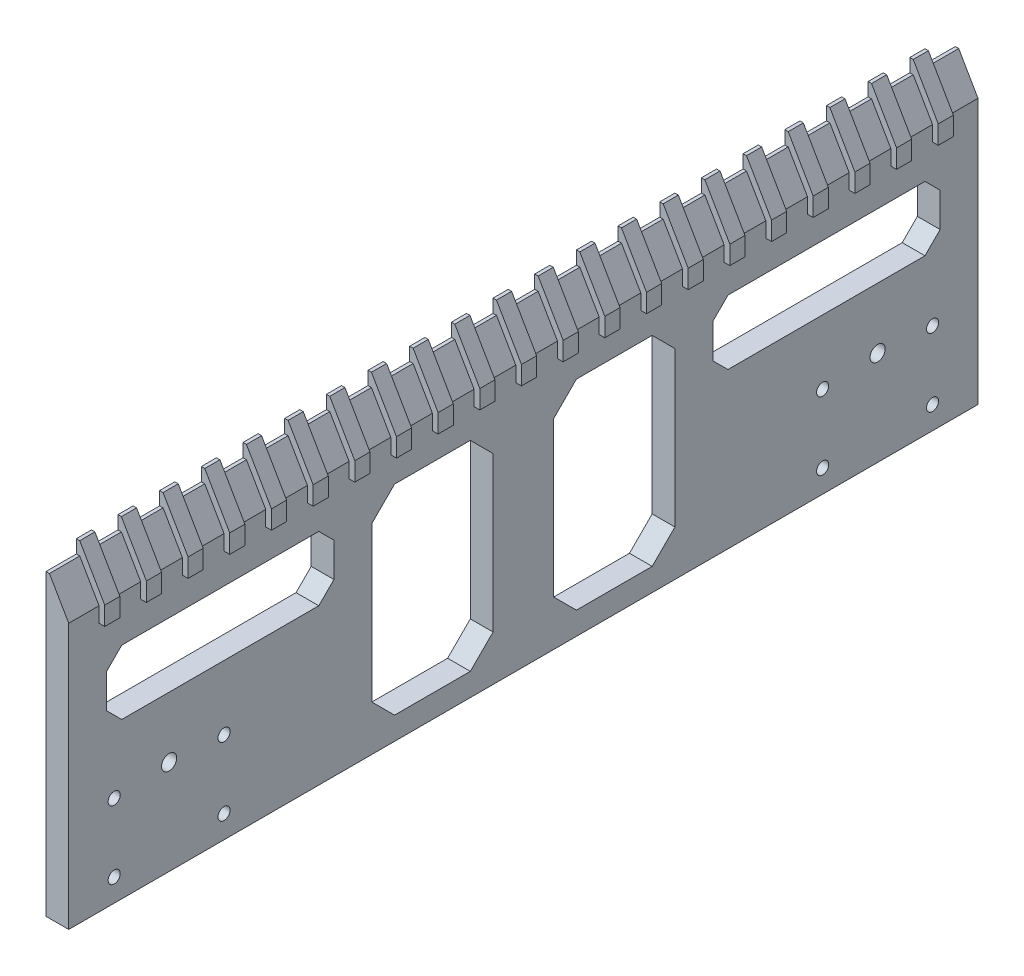
from build123d import *

# Parameters (mm, degrees)
SKETCH_1_W                  = 240
SKETCH_1_H                  = 70
EXTRUDE_1_DEPTH             = 6
CUT_EXTRUDE_2_DEPTH         = 251.071989635
EXTRUDE_2_DEPTH             = 240
EXTRUDE_3_DEPTH             = 2
PATTERN_LINEAR_1_COUNT      = 11
PATTERN_LINEAR_1_PITCH      = 11
PATTERN_LINEAR_1_COUNT_DIR2 = 11
PATTERN_LINEAR_1_PITCH_DIR2 = 11
HOLE_WIZARD_1_D             = 3.2
HOLE_WIZARD_1_CBORE_D       = 6
HOLE_WIZARD_1_CBORE_DEPTH   = 3.4
SKETCH_16_R                 = 2
CUT_EXTRUDE_3_DEPTH         = 10


with BuildPart() as part:
    # 草图1 → 凸台-拉伸1 (new body)
    with BuildSketch(Plane(origin=(0, 0, 0), x_dir=(0, 0, -1), z_dir=(1, 0, 0))):
        with Locations((120, -35)):
            Rectangle(SKETCH_1_W, SKETCH_1_H)
    extrude(amount=EXTRUDE_1_DEPTH)

    # 草图3 → 切除-拉伸2 (cut, through all)
    with BuildSketch(Plane(origin=(6, 0, 0), x_dir=(0, 0, -1), z_dir=(1, 0, 0))):
        Polygon((14, -12), (66, -12), (70, -16), (70, -25), (66, -29), (14, -29), (10, -25), (10, -16), align=None)
        Polygon((80, -17.2), (86, -11.2), (106, -11.2), (112, -17.2), (112, -58), (106, -64), (86, -64), (80, -58), align=None)
    cut_extrude_2 = extrude(amount=-CUT_EXTRUDE_2_DEPTH, mode=Mode.SUBTRACT)

    # 草图6 → 凸台-拉伸2 (add)
    with BuildSketch(Plane.XY):
        Polygon((6, 0), (0, 0), (0, 8.833459119), (0.9, 8.833459119), align=None)
    extrude(amount=-EXTRUDE_2_DEPTH)

    # 草图8 → 凸台-拉伸3 (add, symmetric)
    with BuildSketch(Plane.XY.offset(-120)):
        Polygon((0, 10.392304845), (0, 12.333459119), (0.9, 12.333459119), (7.5, 0.901923789), (7.5, -4), (6, -4), (6, 0), (0.9, 8.833459119), (0, 8.833459119), align=None)
    extrude_3 = extrude(amount=EXTRUDE_3_DEPTH, both=True)

    # 阵列(线性)1: Extrude 3 11 × 11
    with Locations(*[Vector(0, 0, 1) * (i * PATTERN_LINEAR_1_PITCH) + Vector(0, 0, -1) * (j * PATTERN_LINEAR_1_PITCH_DIR2) for i in range(PATTERN_LINEAR_1_COUNT) for j in range(PATTERN_LINEAR_1_COUNT_DIR2) if (i, j) != (0, 0)]):
        add(extrude_3)

    # 打孔尺寸(%根据)内六角圆柱头螺钉的类型1 (through all)
    with Locations(Plane.ZY):
        with Locations((-41, -46), (-12, -46), (-12, -64), (-41, -64)):
            hole_wizard_1 = CounterBoreHole(HOLE_WIZARD_1_D / 2, HOLE_WIZARD_1_CBORE_D / 2, HOLE_WIZARD_1_CBORE_DEPTH)

    # 草图16 → 切除-拉伸3 (cut)
    with BuildSketch(Plane.ZY):
        with Locations((-26.5, -45.023268437)):
            Circle(SKETCH_16_R)
    cut_extrude_3 = extrude(amount=-CUT_EXTRUDE_3_DEPTH, mode=Mode.SUBTRACT)

    # 镜向1: 打孔尺寸(%根据)内六角圆柱头螺钉的类型1 across plane
    add(hole_wizard_1.mirror(Plane.XY.offset(-120)), mode=Mode.SUBTRACT)

    # 镜向2: 切除-拉伸2, 切除-拉伸3 across plane
    add(cut_extrude_2.mirror(Plane.XY.offset(-120)), mode=Mode.SUBTRACT)
    add(cut_extrude_3.mirror(Plane.XY.offset(-120)), mode=Mode.SUBTRACT)


solid = part.part
